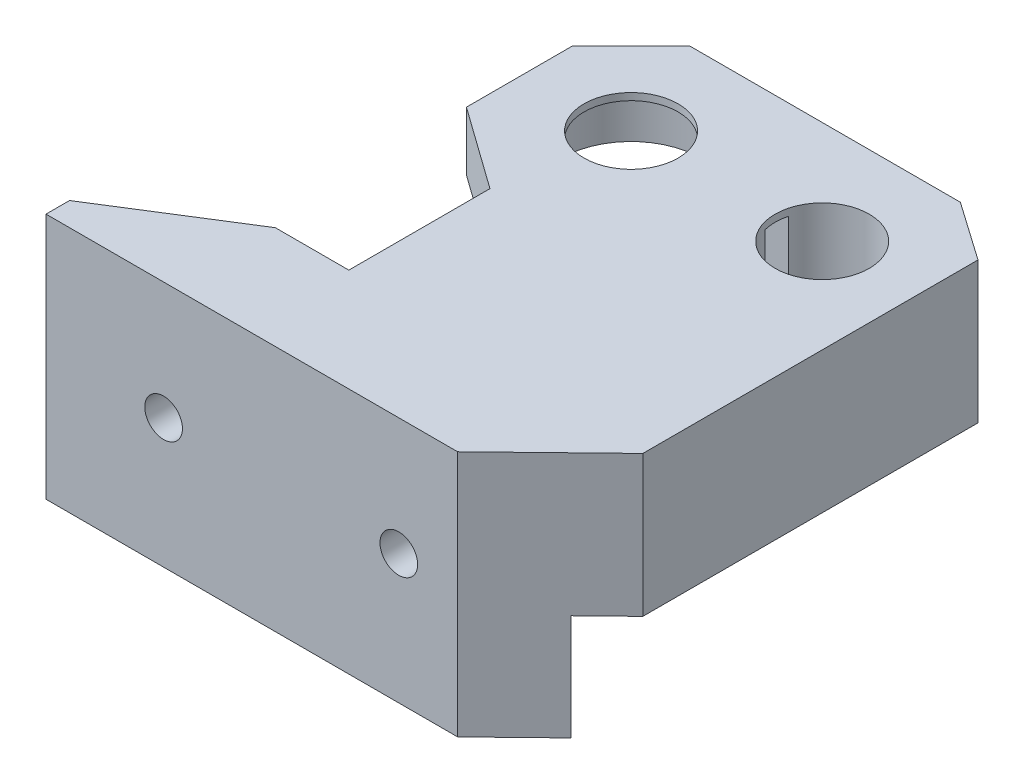
from build123d import *

# Parameters (mm, degrees)
SKETCH1_R           = 4
BOSS_EXTRUDE1_DEPTH = 5
BOSS_EXTRUDE2_DEPTH = 7
BOSS_EXTRUDE3_DEPTH = 16
BOSS_EXTRUDE4_START = 2.5
SKETCH6_R           = 7
SKETCH6_R_2         = 4
BOSS_EXTRUDE4_DEPTH = 2.5
CUT_EXTRUDE1_DEPTH  = 4.4
CUT_EXTRUDE2_DEPTH  = 45.33083013
SKETCH8_R           = 1.6
CUT_EXTRUDE3_DEPTH  = 50.235403928
SKETCH9_R           = 3
CUT_EXTRUDE4_DEPTH  = 4


with BuildPart() as part:
    # Sketch1 → Boss-Extrude1 (new body)
    with BuildSketch(Plane(origin=(0, 0, 0), x_dir=(1, 0, 0), z_dir=(0, 1, 0))):
        Polygon((-3.75, 8.75), (19.25, 8.75), (24.25, 5.25), (24.25, -23.25), (16.25, -31), (-18.75, -31), (-18.75, -29), (-8, -22.25), (-1.75, -22.25), (-1.75, -10.25), (-8.75, -5.25), (-8.75, 3.75), align=None)
        Circle(SKETCH1_R, mode=Mode.SUBTRACT)
        with Locations((16.25, 0)):
            Circle(SKETCH1_R, mode=Mode.SUBTRACT)
    extrude(amount=BOSS_EXTRUDE1_DEPTH)

    # Sketch2 → Boss-Extrude2 (add)
    with BuildSketch(Plane.XZ):
        Polygon((24.25, 23.25), (24.25, -5.25), (20.75, -5.25), (20.75, 22.25), (-8, 22.25), (-14.37037037, 26.25), (21.153225806, 26.25), align=None)
    extrude(amount=BOSS_EXTRUDE2_DEPTH)

    # Sketch3 → Boss-Extrude3 (add)
    with BuildSketch(Plane.XZ):
        Polygon((-14.37037037, 26.25), (21.153225806, 26.25), (16.25, 31), (-18.75, 31), (-18.75, 29), align=None)
    extrude(amount=BOSS_EXTRUDE3_DEPTH)

    # Sketch6 → Boss-Extrude4 (add)
    with BuildSketch(Plane.XZ.offset(BOSS_EXTRUDE4_START)):
        with Locations((16.25, 0)):
            Circle(SKETCH6_R)
        with Locations((16.25, 0)):
            Circle(SKETCH6_R_2, mode=Mode.SUBTRACT)
    extrude(amount=-BOSS_EXTRUDE4_DEPTH)

    # Sketch4 → Cut-Extrude1 (cut)
    with BuildSketch(Plane.XZ):
        with BuildLine():
            Line((5.883782294, -1), (12.377016654, -1))
            ThreePointArc((12.377016654, -1), (12.25, 0), (12.377016654, 1))
            Line((12.377016654, 1), (5.883782294, 1))
            ThreePointArc((5.883782294, 1), (-5.968156673, 0), (5.883782294, -1))
        make_face()
    extrude(amount=-CUT_EXTRUDE1_DEPTH, mode=Mode.SUBTRACT)

    # Sketch7 → Cut-Extrude2 (cut, through all)
    with BuildSketch(Plane.XZ.offset(-4.4)):
        with BuildLine():
            Line((5.883782294, -1), (12.377016654, -1))
            ThreePointArc((12.377016654, -1), (12.25, 0), (12.377016654, 1))
            Line((12.377016654, 1), (5.883782294, 1))
            ThreePointArc((5.883782294, 1), (-5.968156673, 0), (5.883782294, -1))
        make_face()
    extrude(amount=CUT_EXTRUDE2_DEPTH, mode=Mode.SUBTRACT)

    # Sketch8 → Cut-Extrude3 (cut, through all)
    with BuildSketch(Plane.XY.offset(31)):
        with Locations((11.25, -5)):
            Circle(SKETCH8_R)
        with Locations((-8.75, -5)):
            Circle(SKETCH8_R)
    extrude(amount=-CUT_EXTRUDE3_DEPTH, mode=Mode.SUBTRACT)

    # Sketch9 → Cut-Extrude4 (cut)
    with BuildSketch(Plane(origin=(0, 0, 22.25), x_dir=(-1, 0, 0), z_dir=(0, 0, -1))):
        with Locations((-11.25, -5)):
            Circle(SKETCH9_R)
        with Locations((8.75, -5)):
            Circle(SKETCH9_R)
    extrude(amount=-CUT_EXTRUDE4_DEPTH, mode=Mode.SUBTRACT)


solid = part.part
